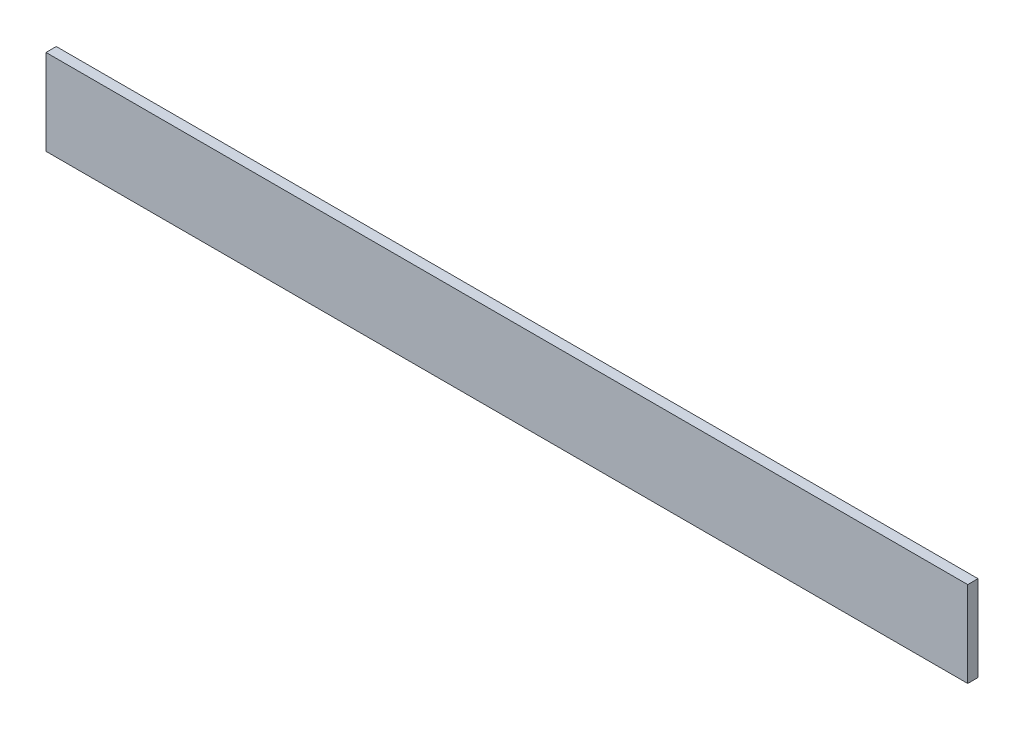
from build123d import *

# Parameters (mm, degrees)
SKETCH_1_W      = 538
SKETCH_1_H      = 50
EXTRUDE_1_DEPTH = 6


with BuildPart() as part:
    # Эскиз1 → Бобышка-Вытянуть1 (new body)
    with BuildSketch(Plane.XY):
        with Locations((95.16967509, -25)):
            Rectangle(SKETCH_1_W, SKETCH_1_H)
    extrude(amount=EXTRUDE_1_DEPTH)


solid = part.part
